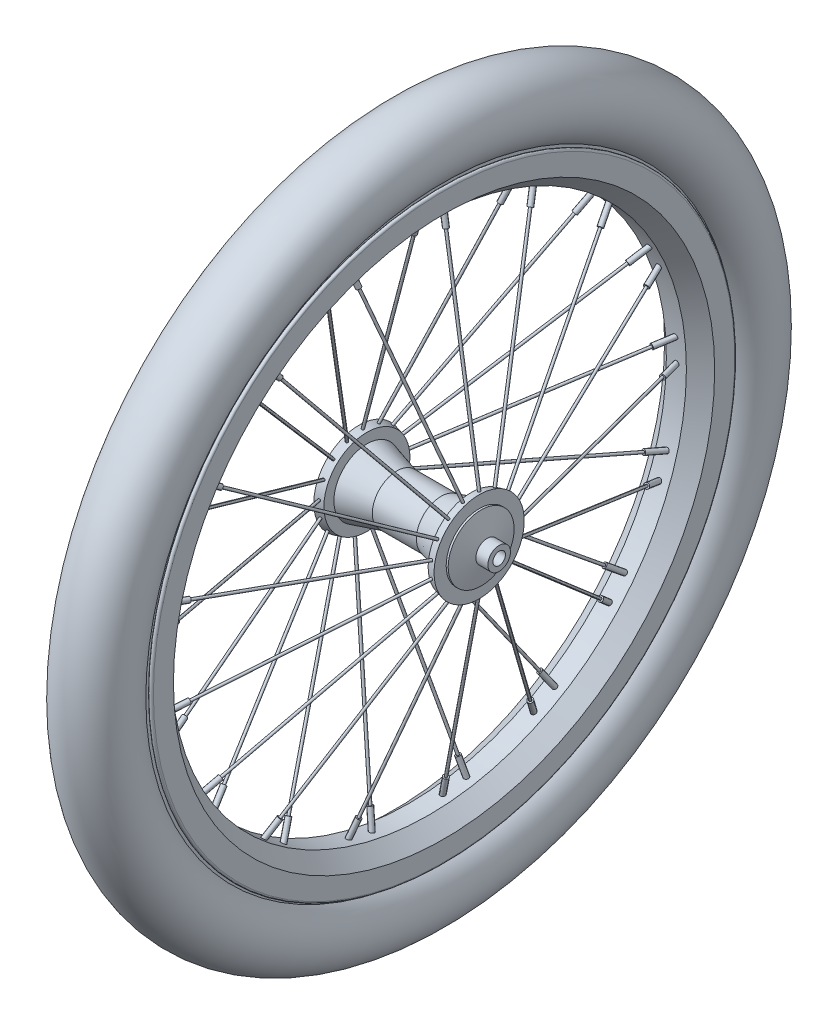
from build123d import *

# Parameters (mm, degrees)
CIRPATTERN1_COUNT = 17


# Read off the part's stored shape, not the designer's step: Revolve2
with BuildPart() as part:
    # Sketch1 → Revolve1 (revolve)
    with BuildSketch(Plane(origin=(0, 0, 0), x_dir=(1, 0, 0), z_dir=(0, 1, 0)), mode=Mode.PRIVATE) as revolve1_sk:
        Polygon((-50.8, 3.96875), (50.8, 3.96875), (50.8, 7.14375), (43.18, 7.14375), (39.37, 20.888307126), (38.1, 20.888307126), (38.1, 28.575), (33.02, 27.238307126), (33.02, 20.888307126), (13.97, 15.607634979), (-13.97, 15.607634979), (-33.02, 20.888307126), (-33.02, 27.238307126), (-38.1, 28.575), (-38.1, 20.888307126), (-39.37, 20.888307126), (-43.18, 7.14375), (-50.8, 7.14375), align=None)
        with BuildLine():
            Line((-6.35, 163.049739587), (6.35, 163.049739587))
            Line((6.35, 163.049739587), (15.875, 171.45))
            Line((15.875, 171.45), (15.875, 184.15))
            ThreePointArc((15.875, 184.15), (14.605, 185.42), (13.335, 184.15))
            Line((13.335, 184.15), (13.335, 173.99))
            Line((13.335, 173.99), (-13.335, 173.99))
            Line((-13.335, 173.99), (-13.335, 184.15))
            ThreePointArc((-13.335, 184.15), (-14.605, 185.42), (-15.875, 184.15))
            Line((-15.875, 184.15), (-15.875, 171.45))
            Line((-15.875, 171.45), (-6.35, 163.049739587))
        make_face()
    revolve(revolve1_sk.sketch.rotate(Axis((-60.772398323, 0, 0), (1, 0, 0)), 180), axis=Axis((-60.772398323, 0, 0), (1, 0, 0)))

    # Revolve2 outline → Revolve2 (revolve)
    with BuildSketch(Plane(origin=(-40.124922506, 10.558011411, 0), x_dir=(0.9670815288226329, -0.254466729868718, 0), z_dir=(0, 0, 1))):
        Polygon((0.79375, 145.400107957), (1.5875, 145.400107957), (1.5875, 158.100231291), (0, 158.100231291), (0, 17.939172278), (0.79375, 17.939172278), align=None)
    revolve2 = revolve(axis=Axis((-40.124922506, 10.558011411, 0), (0.254466729868718, 0.9670815288226329, 0)))

    # Sketch3 → Revolve3 (revolve)
    with BuildSketch(Plane(origin=(0, 0, 0), x_dir=(1, 0, 0), z_dir=(0, 1, 0))):
        Polygon((35.56, 27.906653563), (0, 163.049739587), (-0.802675632, 163.049739587), (-1.641536885, 163.049739587), (1.590190585, 150.767804171), (2.357811548, 150.969787138), (34.792379036, 27.704670596), align=None)
    revolve3 = revolve(axis=Axis((0, 0, -163.049739587), (0.25446672986871854, 0, 0.9670815288226328)))

    # CirPattern1: Revolve2, Revolve3 ×17 about axis
    cirpattern1_axis = Axis((0, 0, 0), (1, 0, 0))
    add([revolve2.rotate(cirpattern1_axis, i * 360 / CIRPATTERN1_COUNT) for i in range(1, CIRPATTERN1_COUNT)])
    add([revolve3.rotate(cirpattern1_axis, i * 360 / CIRPATTERN1_COUNT) for i in range(1, CIRPATTERN1_COUNT)])

    # Sketch4 → Revolve4 (revolve)
    with BuildSketch(Plane(origin=(0, 0, 0), x_dir=(1, 0, 0), z_dir=(0, 1, 0)), mode=Mode.PRIVATE) as revolve4_sk:
        with BuildLine():
            Line((-13.335, 186.69), (-13.335, 173.99))
            Line((-13.335, 173.99), (13.335, 173.99))
            Line((13.335, 173.99), (13.335, 186.69))
            ThreePointArc((13.335, 186.69), (0, 226.695), (-13.335, 186.69))
        make_face()
    revolve(revolve4_sk.sketch.rotate(Axis((0, 0, 0), (1, 0, 0)), 180), axis=Axis((0, 0, 0), (1, 0, 0)))


solid = part.part
